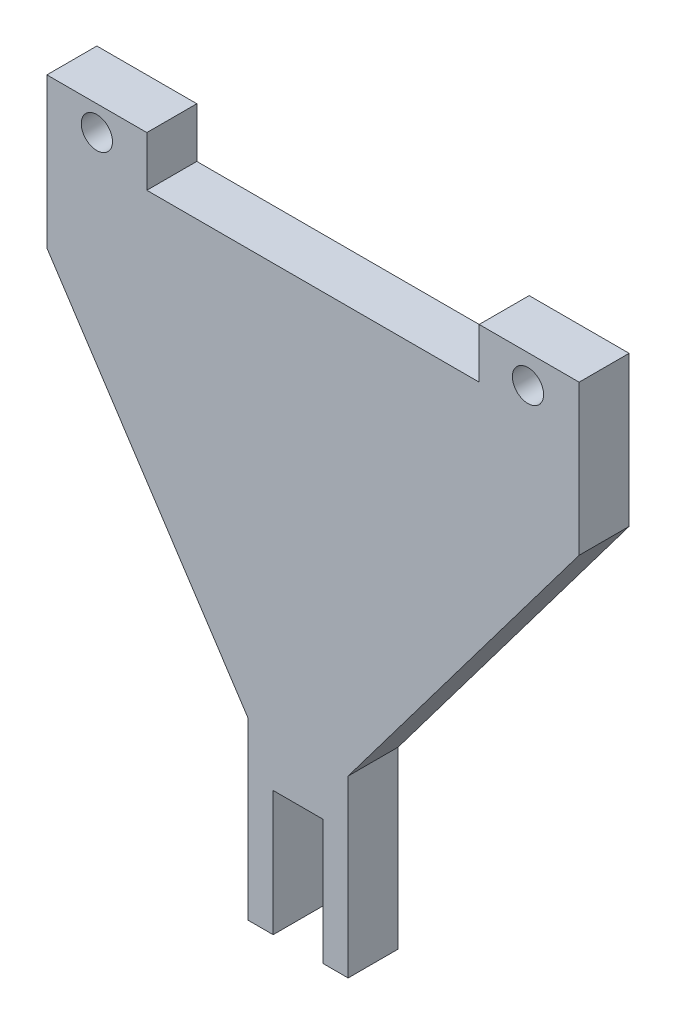
from build123d import *

# Parameters (mm, degrees)
BOSS_EXTRUDE1_DEPTH = 5.08
SKETCH2_R           = 1.5875
CUT_EXTRUDE1_DEPTH  = 50.083323044
SKETCH3_R           = 1.5875
CUT_EXTRUDE2_DEPTH  = 50.083323044
CAVITY2_START       = -4.051115689
CAVITY2_OUTLINE_R   = 1.5875
CAVITY2_DEPTH       = 5.08
CUT_EXTRUDE3_DEPTH  = 50.083323044
SKETCH7_W           = 5.08
SKETCH7_H           = 11.047605328
CUT_EXTRUDE4_DEPTH  = 50.083323044


# Read off the part's stored shape, not the designer's step: Cavity2
with BuildPart() as part:
    # Sketch1 → Boss-Extrude1 (new body)
    with BuildSketch(Plane.XY):
        Polygon((-27.051, 40.64), (-16.891, 40.64), (-16.891, 35.56), (16.891, 35.56), (16.891, 40.64), (27.051, 40.64), (27.051, 30.48), (27.051, -40.64), (-27.051, -40.64), (-27.051, 30.48), align=None)
    extrude(amount=BOSS_EXTRUDE1_DEPTH)

    # Sketch2 → Cut-Extrude1 (cut, through all)
    with BuildSketch(Plane.XY.offset(5.08)):
        with Locations((-21.971, 38.1)):
            Circle(SKETCH2_R)
    extrude(amount=-CUT_EXTRUDE1_DEPTH, mode=Mode.SUBTRACT)

    # Sketch3 → Cut-Extrude2 (cut, through all)
    with BuildSketch(Plane(origin=(0, 0, 0), x_dir=(-1, 0, 0), z_dir=(0, 0, -1))):
        with Locations((-21.851181845, 37.741299139)):
            Circle(SKETCH3_R)
    extrude(amount=-CUT_EXTRUDE2_DEPTH, mode=Mode.SUBTRACT)

    # Cavity2 outline → Cavity2 (cut)
    with BuildSketch(Plane.YZ.offset(CAVITY2_START)):
        with BuildLine():
            ThreePointArc((-24.98622483, 5.08), (-25.105854872, 2.538856915), (-25.266867575, 0))
            Line((-25.266867575, 0), (-12.505553834, 0))
            ThreePointArc((-12.505553834, 0), (-11.65861771, 2.5332542), (-10.853159162, 5.08))
            Line((-10.853159162, 5.08), (-24.98622483, 5.08))
        make_face()
        with Locations((-18.473159162, 2.54)):
            Circle(CAVITY2_OUTLINE_R, mode=Mode.SUBTRACT)
    extrude(amount=CAVITY2_DEPTH, mode=Mode.SUBTRACT)

    # Sketch4 → Cut-Extrude3 (cut, through all)
    with BuildSketch(Plane.XY.offset(5.08)):
        Polygon((-4.051115689, -24.98622483), (-4.051115689, -23.553159162), (-6.591115689, -23.553159162), (-6.591115689, -5.773159162), (-27.051, 25.4), (-27.051, -40.64), (27.051, -40.64), (27.051, 25.4), (3.568884311, -5.773159162), (3.568884311, -23.553159162), (1.028884311, -23.553159162), (1.028884311, -24.98622483), align=None)
    extrude(amount=-CUT_EXTRUDE3_DEPTH, mode=Mode.SUBTRACT)

    # Sketch7 → Cut-Extrude4 (cut, through all)
    with BuildSketch(Plane(origin=(0, 0, 0), x_dir=(-1, 0, 0), z_dir=(0, 0, -1))):
        with Locations((1.511115689, -18.029356498)):
            Rectangle(SKETCH7_W, SKETCH7_H)
    extrude(amount=-CUT_EXTRUDE4_DEPTH, mode=Mode.SUBTRACT)


solid = part.part
